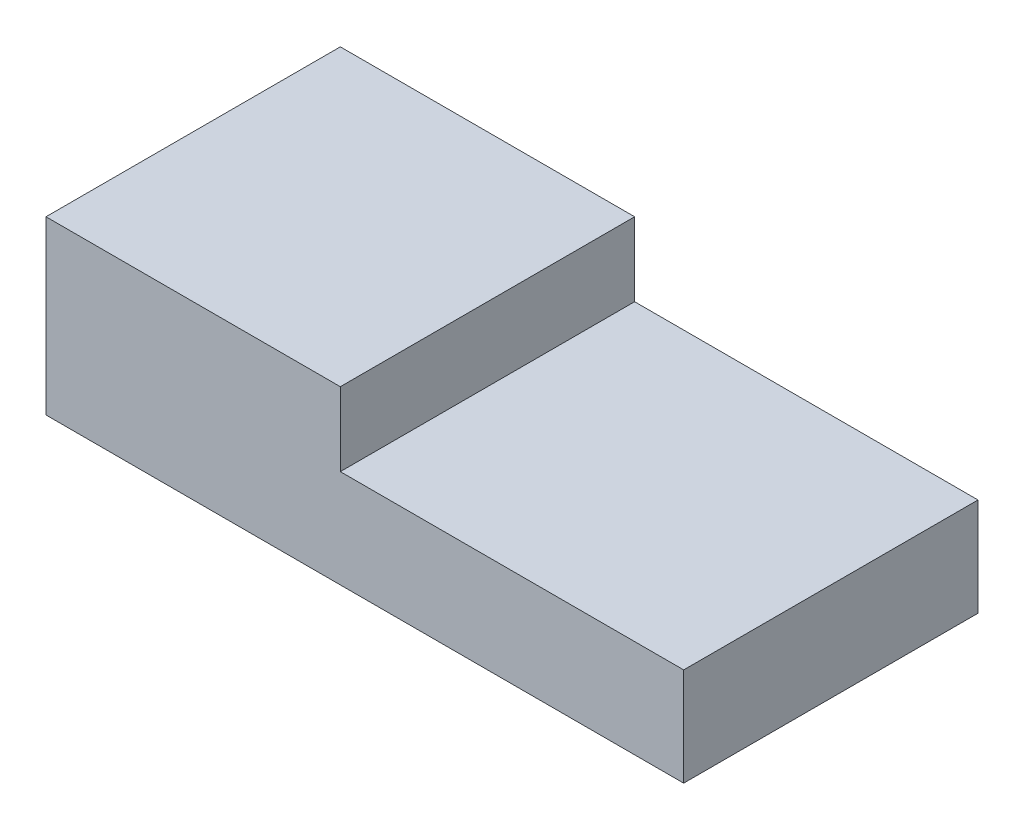
from build123d import *

# Parameters (mm, degrees)
SKETCH1_W           = 60
SKETCH1_H           = 20
BOSS_EXTRUDE1_DEPTH = 130
SKETCH2_W           = 60
SKETCH2_H           = 60
BOSS_EXTRUDE2_DEPTH = 15


with BuildPart() as part:
    # Sketch1 → Boss-Extrude1 (new body)
    with BuildSketch(Plane(origin=(0, 0, 0), x_dir=(0, 0, -1), z_dir=(1, 0, 0))):
        with Locations((1.866028708, -8.133971292)):
            Rectangle(SKETCH1_W, SKETCH1_H)
    extrude(amount=BOSS_EXTRUDE1_DEPTH)

    # Sketch2 → Boss-Extrude2 (add)
    with BuildSketch(Plane(origin=(0, 1.866028708, 0), x_dir=(1, 0, 0), z_dir=(0, 1, 0))):
        with Locations((30, 1.866028708)):
            Rectangle(SKETCH2_W, SKETCH2_H)
    extrude(amount=BOSS_EXTRUDE2_DEPTH)


solid = part.part
